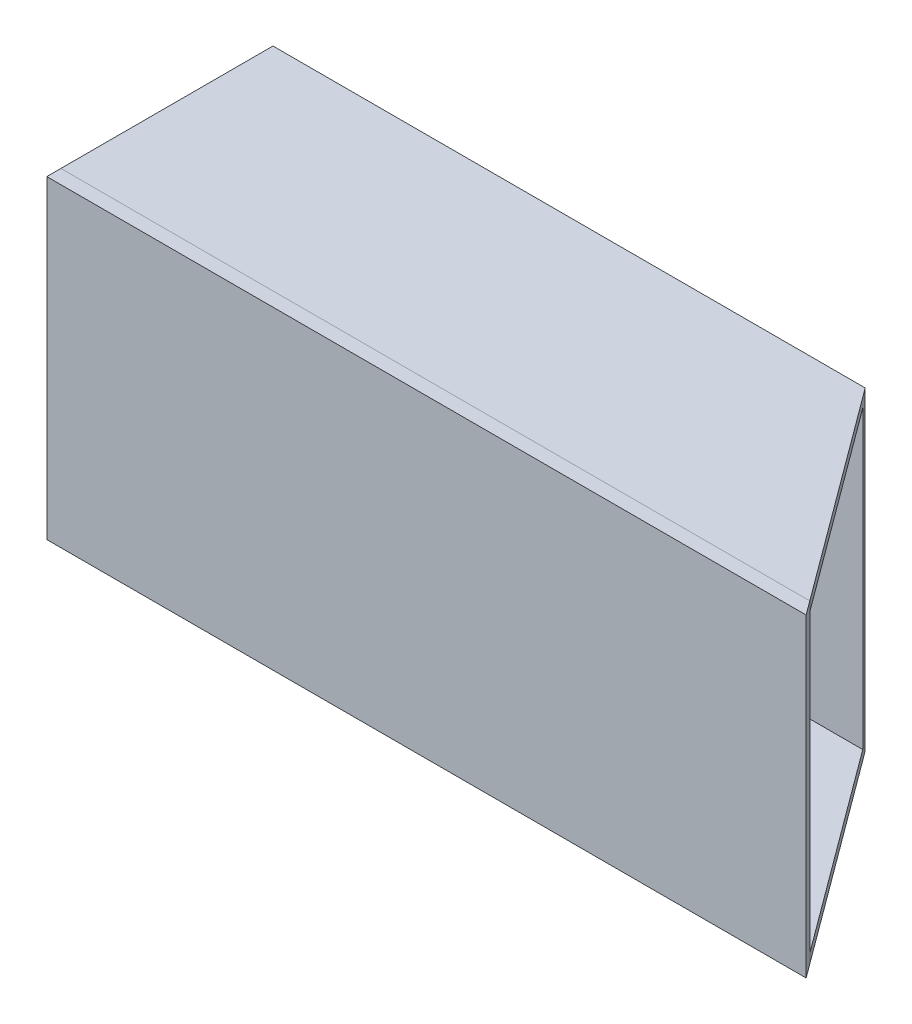
from build123d import *

# Parameters (mm, degrees)
SZKIC1_W                        = 157.665871289
SZKIC1_H                        = 63
DODANIE_WYCI_GNI_CIE1_DEPTH     = 43.2
WYTNIJ_WYCI_GNI_CIE1_DEPTH      = 70
SKORUPA3_START                  = -70.275069684
SKORUPA3_OUTLINE_W              = 67
SKORUPA3_OUTLINE_H              = 48.2
SKORUPA3_DEPTH                  = 3
SKORUPA3_START_2                = -127.5
SKORUPA3_2_DEPTH                = 63
SKORUPA3_START_3                = -129.5
SKORUPA3_3_DEPTH                = 67
SKORUPA3_4_DEPTH                = 2
SKORUPA3_START_4                = -64.5
SKORUPA3_5_DEPTH                = 2
WYTNIJ_WYCI_GNI_CIE3_DEPTH      = 125.94228845
WYTNIJ_WYCI_GNI_CIE3_DEPTH_BACK = 125.94228845


with BuildPart() as part:
    # Szkic1 → Dodanie-wyciągnięcie1 (new body)
    with BuildSketch(Plane.XY):
        with Locations((11.557865961, -96)):
            Rectangle(SZKIC1_W, SZKIC1_H)
    extrude(amount=-DODANIE_WYCI_GNI_CIE1_DEPTH)

    # Szkic2 → Wytnij-wyciągnięcie1 (cut)
    with BuildSketch(Plane.XZ.offset(127.5)):
        Polygon((91.579553956, 3.037978518), (97.149949113, -5.556810967), (99.754808073, -53.374579011), (51.257151272, -51.543792256), align=None)
    extrude(amount=-WYTNIJ_WYCI_GNI_CIE1_DEPTH, mode=Mode.SUBTRACT)

    # Skorupa3: read off the stored shape, not the designer's step
    # Skorupa3 outline → Skorupa3 (add)
    with BuildSketch(Plane.YZ.offset(SKORUPA3_START)):
        with Locations((-96, -21.1)):
            Rectangle(SKORUPA3_OUTLINE_W, SKORUPA3_OUTLINE_H)
    extrude(amount=SKORUPA3_DEPTH)

    # Skorupa3 2 outline → Skorupa3 2 (cut)
    with BuildSketch(Plane(origin=(0, 0, 0), x_dir=(1, 0, 0), z_dir=(0, 1, 0)).offset(SKORUPA3_START_2)):
        Polygon((57.421146073, 43.2), (-67.275069684, 43.2), (-67.275069684, 0), (89.335240673, 0), align=None)
    extrude(amount=SKORUPA3_2_DEPTH, mode=Mode.SUBTRACT)

    # Skorupa3 3 outline → Skorupa3 3 (add)
    with BuildSketch(Plane(origin=(0, 0, 0), x_dir=(1, 0, 0), z_dir=(0, 1, 0)).offset(SKORUPA3_START_3)):
        Polygon((95.281348873, -3), (59.673493323, 45.2), (-67.275069684, 45.2), (-67.275069684, 43.2), (57.421146073, 43.2), (89.335240673, 0), (-67.275069684, 0), (-67.275069684, -3), align=None)
    extrude(amount=SKORUPA3_3_DEPTH)

    # Skorupa3 4 outline → Skorupa3 4 (add)
    with BuildSketch(Plane(origin=(0, 0, 0), x_dir=(1, 0, 0), z_dir=(0, 1, 0)).offset(SKORUPA3_START_3)):
        Polygon((57.421146073, 43.2), (-67.275069684, 43.2), (-67.275069684, 0), (89.335240673, 0), align=None)
    extrude(amount=SKORUPA3_4_DEPTH)

    # Skorupa3 5 outline → Skorupa3 5 (add)
    with BuildSketch(Plane(origin=(0, 0, 0), x_dir=(1, 0, 0), z_dir=(0, 1, 0)).offset(SKORUPA3_START_4)):
        Polygon((57.421146073, 43.2), (-67.275069684, 43.2), (-67.275069684, 0), (89.335240673, 0), align=None)
    extrude(amount=SKORUPA3_5_DEPTH)

    # Szkic6 → Wytnij-wyciągnięcie3 (cut, two sides: drawn at the far end of the back side and taken through both)
    with BuildSketch(Plane.XZ.offset(129.5).offset(-WYTNIJ_WYCI_GNI_CIE3_DEPTH_BACK)):
        Polygon((-150.660373393, -324.866196497), (55.943641693, -45.2), (91.551497243, 3), (298.155512329, 282.666196497), (857.487905323, -130.541833674), (408.672019601, -738.074226668), align=None)
    extrude(amount=WYTNIJ_WYCI_GNI_CIE3_DEPTH + WYTNIJ_WYCI_GNI_CIE3_DEPTH_BACK, mode=Mode.SUBTRACT)


with BuildPart() as body_2:
    # Podziel3: the piece on the far side of the plane
    add(part.part)
    split(bisect_by=Plane(origin=(0, 0, 0), x_dir=(-1, 0, 0), z_dir=(0, 0, -1)), keep=Keep.BOTTOM)


with BuildPart() as part_1:
    add(part.part)

    # Podziel3
    split(bisect_by=Plane(origin=(0, 0, 0), x_dir=(-1, 0, 0), z_dir=(0, 0, -1)), keep=Keep.TOP)


solid = Compound([body_2.part, part_1.part])
